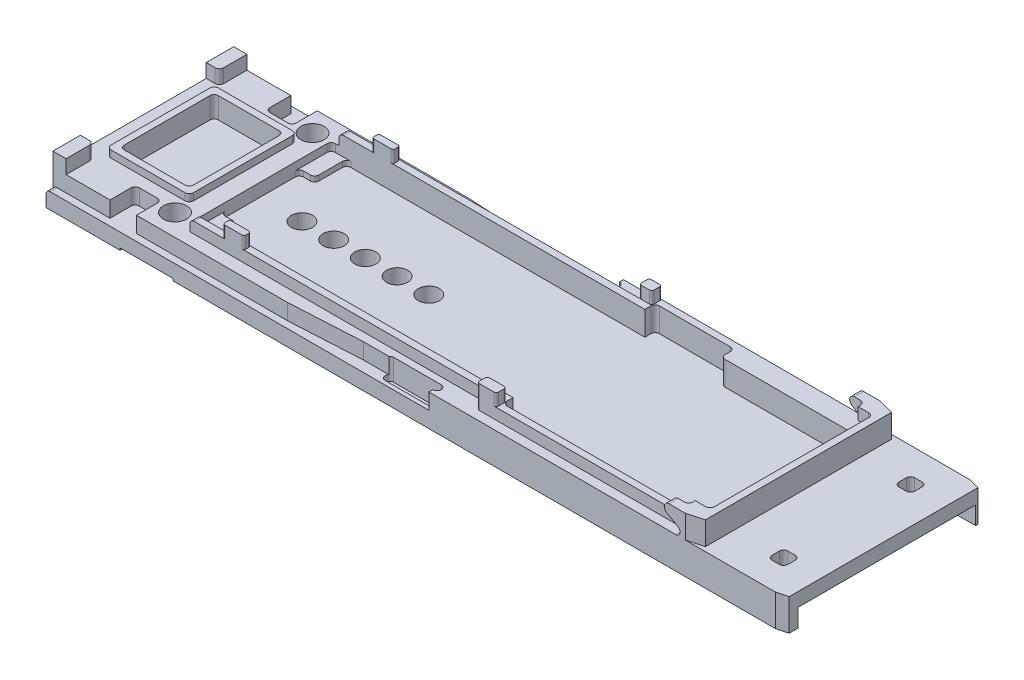
from build123d import *
from OCP.BRepFilletAPI import BRepFilletAPI_MakeChamfer

# Parameters (mm, degrees)
SKETCH1_W                                    = 70
SKETCH1_H                                    = 18.4
BOSS_EXTRUDE1_DEPTH                          = 4.05
CUT_EXTRUDE1_DEPTH                           = 2.28
SKETCH5_W                                    = 6.55
SKETCH5_H                                    = 8.9
CUT_EXTRUDE2_DEPTH                           = 2.38
SKETCH17_W                                   = 70
SKETCH17_H                                   = 18.4
CUT_EXTRUDE8_DEPTH                           = 1.05
SKETCH18_W                                   = 7.8
SKETCH18_H                                   = 10.15
SKETCH18_W_2                                 = 6.55
SKETCH18_H_2                                 = 8.9
BOSS_EXTRUDE3_DEPTH                          = 3.67
CSK_FOR_M2_COUNTERSUNK_FLAT_HEAD_SCR_2_COUNT = 2
CSK_FOR_M2_COUNTERSUNK_FLAT_HEAD_SCR_2_PITCH = 13
CUT_EXTRUDE5_DEPTH                           = 2.55
SKETCH19_W                                   = 1.25
SKETCH19_H                                   = 2.6
BOSS_EXTRUDE4_DEPTH                          = 4.3
SKETCH20_W                                   = 2.5
SKETCH20_H                                   = 2.385
CUT_EXTRUDE9_DEPTH                           = 1.5
SKETCH21_W                                   = 2
SKETCH21_H                                   = 0.65
BOSS_EXTRUDE5_DEPTH                          = 5.2
BOSS_EXTRUDE6_DEPTH                          = 5.2
CHAMFER2_SIZE                                = 1.5
CHAMFER2_SIZE2                               = 0.401923789
CHAMFER1_SIZE                                = 1
CHAMFER1_SIZE2                               = 0.267949192
CUT_EXTRUDE10_DEPTH                          = 37.313083042
CUT_EXTRUDE7_DEPTH                           = 0.2
CHAMFER2_OF_MIRROR1_SIZE2                    = 1.5
CHAMFER2_OF_MIRROR1_SIZE                     = 0.401923789
CUT_EXTRUDE12_DEPTH                          = 0.875
CUT_EXTRUDE13_START                          = -0.875
CUT_EXTRUDE13_DEPTH                          = 0.875
SKETCH26_W                                   = 1.8
SKETCH26_H                                   = 0.95
SKETCH26_W_2                                 = 1.18
BOSS_EXTRUDE8_DEPTH                          = 5.2
FILLET1_R                                    = 0.4
FILLET2_R                                    = 0.2
SKETCH23_W                                   = 0.65
SKETCH23_H                                   = 15.4
BOSS_EXTRUDE7_DEPTH                          = 1.15
SKETCH27_W                                   = 13.1
SKETCH27_H                                   = 1.275
BOSS_EXTRUDE9_DEPTH                          = 2.28
FILLET3_R                                    = 0.4
CUT_EXTRUDE11_DEPTH                          = 1.7
SKETCH31_W                                   = 1.45
SKETCH31_H                                   = 3.025
BOSS_EXTRUDE10_DEPTH                         = 0.5
SKETCH32_W                                   = 4.5
SKETCH32_H                                   = 0.65
CUT_EXTRUDE14_DEPTH                          = 0.55
CUT_EXTRUDE15_DEPTH                          = 37.43765223
FILLET5_R                                    = 0.4
FILLET6_R                                    = 0.4
FILLET7_R                                    = 0.4
FILLET8_R                                    = 0.4
SKETCH34_R                                   = 1
CUT_EXTRUDE16_DEPTH                          = 37.351133407
LPATTERN1_COUNT                              = 5
LPATTERN1_PITCH                              = 3


with BuildPart() as part:
    # Sketch1 → Boss-Extrude1 (new body)
    with BuildSketch(Plane(origin=(0, 0, 0), x_dir=(1, 0, 0), z_dir=(0, 1, 0))):
        Rectangle(SKETCH1_W, SKETCH1_H)
    extrude(amount=BOSS_EXTRUDE1_DEPTH)

    # Sketch2 → Cut-Extrude1 (cut)
    with BuildSketch(Plane(origin=(0, 4.05, 0), x_dir=(1, 0, 0), z_dir=(0, 1, 0))):
        Polygon((-23.95, 6.725), (-23.95, -6.725), (6.7, -6.725), (6.7, -7.7), (26.3, -7.7), (26.3, 7.7), (5.7, 7.7), (5.7, 6.725), align=None)
    extrude(amount=-CUT_EXTRUDE1_DEPTH, mode=Mode.SUBTRACT)

    # Sketch5 → Cut-Extrude2 (cut)
    with BuildSketch(Plane(origin=(0, 4.05, 0), x_dir=(1, 0, 0), z_dir=(0, 1, 0))):
        with Locations((-29.475, 0)):
            Rectangle(SKETCH5_W, SKETCH5_H)
    extrude(amount=-CUT_EXTRUDE2_DEPTH, mode=Mode.SUBTRACT)

    # Sketch17 → Cut-Extrude8 (cut)
    with BuildSketch(Plane(origin=(0, 4.05, 0), x_dir=(1, 0, 0), z_dir=(0, 1, 0))):
        Rectangle(SKETCH17_W, SKETCH17_H)
        Polygon((-23.2, 7.375), (-23.2, -7.375), (5.05, -7.375), (5.05, -8.325), (26.95, -8.325), (26.95, 8.325), (5.05, 8.325), (5.05, 7.375), align=None, mode=Mode.SUBTRACT)
    extrude(amount=-CUT_EXTRUDE8_DEPTH, mode=Mode.SUBTRACT)

    # Sketch18 → Boss-Extrude3 (add)
    with BuildSketch(Plane(origin=(0, 0, 0), x_dir=(1, 0, 0), z_dir=(0, 1, 0))):
        with Locations((-29.475, 0)):
            Rectangle(SKETCH18_W, SKETCH18_H)
        with Locations((-29.475, 0)):
            Rectangle(SKETCH18_W_2, SKETCH18_H_2, mode=Mode.SUBTRACT)
    extrude(amount=BOSS_EXTRUDE3_DEPTH)

    # Sketch6 → CSK for M2 Countersunk Flat Head Screw1 (revolve, cut)
    with BuildSketch(Plane(origin=(-25.5, 0, -6.5), x_dir=(0, 0, -1), z_dir=(1, 0, 0))):
        Polygon((0, 0), (0, 4.05), (1.1, 4.05), (1.1, 1.3), (2.2, 0.2), (2.2, 0), align=None)
    csk_for_m2_countersunk_flat_head_screw1 = revolve(axis=Axis((-25.5, -6.35, -6.5), (0, 1, 0)), mode=Mode.SUBTRACT)

    # CSK for M2 Countersunk Flat Head Scr 2: CSK for M2 Countersunk Flat Head Screw1 ×2
    with Locations(*[(0, 0, i * CSK_FOR_M2_COUNTERSUNK_FLAT_HEAD_SCR_2_PITCH) for i in range(1, CSK_FOR_M2_COUNTERSUNK_FLAT_HEAD_SCR_2_COUNT)]):
        add(csk_for_m2_countersunk_flat_head_screw1, mode=Mode.SUBTRACT)

    # Sketch13 → Cut-Extrude5 (cut)
    with BuildSketch(Plane(origin=(0, 4.05, 0), x_dir=(1, 0, 0), z_dir=(0, 1, 0))):
        Polygon((-35, 9.2), (1.2, 9.2), (1.2, 8.175), (-6, 8.175), (-12.8, 8.55), (-35, 8.55), align=None)
    cut_extrude5 = extrude(amount=-CUT_EXTRUDE5_DEPTH, mode=Mode.SUBTRACT)

    # Sketch19 → Boss-Extrude4 (add)
    with BuildSketch(Plane(origin=(0, 0, 0), x_dir=(1, 0, 0), z_dir=(0, 1, 0))):
        with Locations((-34.375, 7.25)):
            Rectangle(SKETCH19_W, SKETCH19_H)
    boss_extrude4 = extrude(amount=BOSS_EXTRUDE4_DEPTH)

    # Sketch20 → Cut-Extrude9 (cut)
    with BuildSketch(Plane(origin=(0, 3, 0), x_dir=(1, 0, 0), z_dir=(0, 1, 0))):
        with Locations((-28.35, 7.3575)):
            Rectangle(SKETCH20_W, SKETCH20_H)
    cut_extrude9 = extrude(amount=-CUT_EXTRUDE9_DEPTH, mode=Mode.SUBTRACT)

    # Sketch21 → Boss-Extrude5 (add)
    with BuildSketch(Plane(origin=(0, 0, 0), x_dir=(1, 0, 0), z_dir=(0, 1, 0))):
        with Locations((-19.1, 7.05)):
            Rectangle(SKETCH21_W, SKETCH21_H)
    boss_extrude5 = extrude(amount=BOSS_EXTRUDE5_DEPTH)

    # Sketch22 → Boss-Extrude6 (add)
    with BuildSketch(Plane.XZ):
        Polygon((24.9, -7.7), (26.95, -7.7), (26.95, -9.2), (22.15, -9.2), (22.15, -8.325), (24.9, -8.325), align=None)
    boss_extrude6 = extrude(amount=-BOSS_EXTRUDE6_DEPTH)

    # Chamfer2
    chamfer2_edges = [part.edges().sort_by_distance(p)[0] for p in [
        (26.95, 4.1, -9.2),
    ]]
    chamfer2_side = [part.faces().sort_by_distance(p)[0] for p in [
        (7.078780224, 1.420191267, -9.2),
    ]]
    chamfer(chamfer2_edges, length=CHAMFER2_SIZE, length2=CHAMFER2_SIZE2, reference=chamfer2_side[0])

    # Chamfer1: one chamfer whose edges measure the first distance from different faces: ONE call of the kernel's chamfer builder (chamfer() names one face for all edges)
    chamfer1_edges_1 = [part.edges().sort_by_distance(p)[0] for p in [
        (35, 1.5, 9.2),
    ]]
    chamfer1_side_1 = [part.faces().sort_by_distance(p)[0] for p in [
        (0, 1.5, 9.2),
    ]]
    chamfer1_edges_2 = [part.edges().sort_by_distance(p)[0] for p in [
        (35, 1.5, -9.2),
    ]]
    chamfer1_side_2 = [part.faces().sort_by_distance(p)[0] for p in [
        (6.691568483, 1.365924153, -9.2),
    ]]
    chamfer1 = BRepFilletAPI_MakeChamfer(part.part.solid().wrapped)
    for e in chamfer1_edges_1:
        chamfer1.Add(CHAMFER1_SIZE, CHAMFER1_SIZE2, e.wrapped, chamfer1_side_1[0].wrapped)  # the first distance lies on this face
    for e in chamfer1_edges_2:
        chamfer1.Add(CHAMFER1_SIZE, CHAMFER1_SIZE2, e.wrapped, chamfer1_side_2[0].wrapped)  # the first distance lies on this face
    add(Compound.cast(chamfer1.Shape()), mode=Mode.REPLACE)

    # Sketch25 → Cut-Extrude10 (cut, through all)
    with BuildSketch(Plane(origin=(0, 3, 0), x_dir=(1, 0, 0), z_dir=(0, 1, 0))):
        with BuildLine():
            Line((31.2, 6.75), (31.9, 6.75))
            ThreePointArc((31.9, 6.75), (32.182842712, 6.632842712), (32.3, 6.35))
            Line((32.3, 6.35), (32.3, 5.65))
            ThreePointArc((32.3, 5.65), (32.182842712, 5.367157288), (31.9, 5.25))
            Line((31.9, 5.25), (31.2, 5.25))
            ThreePointArc((31.2, 5.25), (30.917157288, 5.367157288), (30.8, 5.65))
            Line((30.8, 5.65), (30.8, 6.35))
            ThreePointArc((30.8, 6.35), (30.917157288, 6.632842712), (31.2, 6.75))
        make_face()
    cut_extrude10 = extrude(amount=-CUT_EXTRUDE10_DEPTH, mode=Mode.SUBTRACT)

    # Sketch16 → Cut-Extrude7 (cut)
    with BuildSketch(Plane.XZ):
        with BuildLine():
            Line((-28, -9.2), (-28, -6.5))
            ThreePointArc((-28, -6.5), (-25.5, -4), (-23, -6.5))
            Line((-23, -6.5), (-23, -9.2))
            Line((-23, -9.2), (-28, -9.2))
        make_face()
    cut_extrude7 = extrude(amount=-CUT_EXTRUDE7_DEPTH, mode=Mode.SUBTRACT)

    # Mirror1: Cut-Extrude5, Boss-Extrude4, Cut-Extrude9, Boss-Extrude5, Boss-Extrude6, Cut-Extrude10, Cut-Extrude7 across plane
    add(cut_extrude5.mirror(Plane.XY), mode=Mode.SUBTRACT)
    add(boss_extrude4.mirror(Plane.XY))
    add(cut_extrude9.mirror(Plane.XY), mode=Mode.SUBTRACT)
    add(boss_extrude5.mirror(Plane.XY))
    add(boss_extrude6.mirror(Plane.XY))
    add(cut_extrude10.mirror(Plane.XY), mode=Mode.SUBTRACT)
    add(cut_extrude7.mirror(Plane.XY), mode=Mode.SUBTRACT)

    # Chamfer2 of Mirror1
    chamfer2_of_mirror1_edges = [part.edges().sort_by_distance(p)[0] for p in [
        (26.95, 4.1, 9.2),
    ]]
    chamfer(chamfer2_of_mirror1_edges, length=CHAMFER2_OF_MIRROR1_SIZE, length2=CHAMFER2_OF_MIRROR1_SIZE2)

    # Sketch29 → Cut-Extrude12 (cut)
    with BuildSketch(Plane.XY.offset(-9.2)):
        with BuildLine():
            Line((23.693911087, 4.360288568), (24.757179677, 3.746410162))
            ThreePointArc((24.757179677, 3.746410162), (24.943550007, 3.296472382), (24.557179677, 3))
            Line((24.557179677, 3), (21.557179677, 3))
            Line((21.557179677, 3), (21.557179677, 5.2))
            Line((21.557179677, 5.2), (23.918911087, 5.2))
            ThreePointArc((23.918911087, 5.2), (23.484244465, 4.86646857), (23.693911087, 4.360288568))
        make_face()
    extrude(amount=CUT_EXTRUDE12_DEPTH, mode=Mode.SUBTRACT)

    # Sketch30 → Cut-Extrude13 (cut)
    with BuildSketch(Plane.XY.offset(9.2).offset(CUT_EXTRUDE13_START)):
        with BuildLine():
            Line((23.693911087, 4.360288568), (24.757179677, 3.746410162))
            ThreePointArc((24.757179677, 3.746410162), (24.943550007, 3.296472382), (24.557179677, 3))
            Line((24.557179677, 3), (21.557179677, 3))
            Line((21.557179677, 3), (21.557179677, 5.2))
            Line((21.557179677, 5.2), (23.918911087, 5.2))
            ThreePointArc((23.918911087, 5.2), (23.484244465, 4.86646857), (23.693911087, 4.360288568))
        make_face()
    extrude(amount=CUT_EXTRUDE13_DEPTH, mode=Mode.SUBTRACT)

    # Sketch26 → Boss-Extrude8 (add)
    with BuildSketch(Plane.XZ):
        with Locations((5.8, 7.85)):
            Rectangle(SKETCH26_W, SKETCH26_H)
        with Locations((5.11, -7.85)):
            Rectangle(SKETCH26_W_2, SKETCH26_H)
    extrude(amount=-BOSS_EXTRUDE8_DEPTH)

    # Fillet1
    fillet1_edges = [part.edges().sort_by_distance(p)[0] for p in [
        (-23.2, 4.05, -7.05),
        (-23.2, 4.05, 7.05),
    ]]
    fillet(fillet1_edges, radius=FILLET1_R)

    # Fillet2
    fillet2_edges = [part.edges().sort_by_distance(p)[0] for p in [
        (-20.1, 4.625, -7.375),
        (-20.1, 4.625, -6.725),
        (-18.1, 4.625, -6.725),
        (-18.1, 4.625, -7.375),
        (-20.1, 4.625, 6.725),
        (-20.1, 4.625, 7.375),
        (-18.1, 4.625, 7.375),
        (-18.1, 4.625, 6.725),
        (4.9, 4.1, 8.325),
        (6.7, 4.625, 7.375),
        (6.7, 4.625, 8.325),
        (4.9, 4.625, 7.375),
        (5.7, 4.625, -7.375),
        (5.7, 4.625, -8.325),
        (4.52, 4.1, -8.325),
        (4.52, 4.625, -7.375),
    ]]
    fillet(fillet2_edges, radius=FILLET2_R)

    # Sketch23 → Boss-Extrude7 (add)
    with BuildSketch(Plane(origin=(0, 4.05, 0), x_dir=(1, 0, 0), z_dir=(0, 1, 0))):
        with Locations((26.625, 0)):
            Rectangle(SKETCH23_W, SKETCH23_H)
    extrude(amount=BOSS_EXTRUDE7_DEPTH)

    # Sketch27 → Boss-Extrude9 (add)
    with BuildSketch(Plane(origin=(0, 1.77, 0), x_dir=(1, 0, 0), z_dir=(0, 1, 0))):
        with Locations((19.75, 7.0625)):
            Rectangle(SKETCH27_W, SKETCH27_H)
    extrude(amount=BOSS_EXTRUDE9_DEPTH)

    # Fillet3
    fillet3_edges = [part.edges().sort_by_distance(p)[0] for p in [
        (13.2, 2.91, -7.7),
        (13.2, 2.91, -6.425),
    ]]
    fillet(fillet3_edges, radius=FILLET3_R)

    # Sketch28 → Cut-Extrude11 (cut)
    with BuildSketch(Plane.XZ):
        Polygon((35, 8.1), (30.8, 8.1), (30.8, -7), (14.2, -7), (14.2, -8.7), (35, -8.7), align=None)
    extrude(amount=-CUT_EXTRUDE11_DEPTH, mode=Mode.SUBTRACT)

    # Sketch31 → Boss-Extrude10 (add)
    with BuildSketch(Plane(origin=(0, 1.77, 0), x_dir=(1, 0, 0), z_dir=(0, 1, 0))):
        with Locations((-23.225, 5.2125)):
            Rectangle(SKETCH31_W, SKETCH31_H)
        with Locations((-23.225, -5.2125)):
            Rectangle(SKETCH31_W, SKETCH31_H)
    extrude(amount=BOSS_EXTRUDE10_DEPTH)

    # Sketch32 → Cut-Extrude14 (cut)
    with BuildSketch(Plane(origin=(0, 1.5, 0), x_dir=(1, 0, 0), z_dir=(0, 1, 0))):
        with Locations((-1.05, 8.5)):
            Rectangle(SKETCH32_W, SKETCH32_H)
        with Locations((-1.05, -8.5)):
            Rectangle(SKETCH32_W, SKETCH32_H)
    extrude(amount=-CUT_EXTRUDE14_DEPTH, mode=Mode.SUBTRACT)

    # Sketch33 → Cut-Extrude15 (cut, through all)
    with BuildSketch(Plane(origin=(0, 0.95, 0), x_dir=(1, 0, 0), z_dir=(0, 1, 0))):
        with BuildLine():
            Line((-3.3, -8.825), (1.2, -8.825))
            ThreePointArc((1.2, -8.825), (1.6, -8.425), (1.2, -8.025))
            Line((1.2, -8.025), (-3.3, -8.025))
            ThreePointArc((-3.3, -8.025), (-3.7, -8.425), (-3.3, -8.825))
        make_face()
    cut_extrude15 = extrude(amount=CUT_EXTRUDE15_DEPTH, mode=Mode.SUBTRACT)

    # Mirror2: Cut-Extrude15 across plane
    add(cut_extrude15.mirror(Plane.XY), mode=Mode.SUBTRACT)

    # Fillet5
    # the kernel refuses this fillet: 0.4 mm, written as the material it adds along each edge
    with BuildSketch(Plane(origin=(5.7, 4.05, -7.7), x_dir=(0, 0, 1), z_dir=(0, -1, 0)), Plane(origin=(6.7, 4.05, 7.7), x_dir=(1, 0, 0), z_dir=(0, -1, 0))) as fillet5_piece_1:
        with BuildLine():
            CenterArc((FILLET5_R, -FILLET5_R), FILLET5_R, 90, 90)
            Line((0, -FILLET5_R), (0, 0))
            Line((0, 0), (FILLET5_R, 0))
        make_face()
    extrude(amount=3.28)
    with BuildSketch(Plane(origin=(26.3, 5.2, 7.7), x_dir=(0, 0, -1), z_dir=(0, -1, 0))) as fillet5_piece_2:
        with BuildLine():
            CenterArc((FILLET5_R, -FILLET5_R), FILLET5_R, 90, 90)
            Line((0, -FILLET5_R), (0, 0))
            Line((0, 0), (FILLET5_R, 0))
        make_face()
    extrude(amount=4.43)
    with BuildSketch(Plane(origin=(-29.6, 3, -6.165), x_dir=(1, 0, 0), z_dir=(0, -1, 0)), Plane(origin=(-29.6, 3, 6.165), x_dir=(0, 0, 1), z_dir=(0, -1, 0))) as fillet5_piece_3:
        with BuildLine():
            CenterArc((FILLET5_R, -FILLET5_R), FILLET5_R, 90, 90)
            Line((0, -FILLET5_R), (0, 0))
            Line((0, 0), (FILLET5_R, 0))
        make_face()
    extrude(amount=2.5)
    with BuildSketch(Plane(origin=(-27.1, 3, -6.165), x_dir=(0, 0, -1), z_dir=(0, -1, 0)), Plane(origin=(-27.1, 3, 6.165), x_dir=(-1, 0, 0), z_dir=(0, -1, 0))) as fillet5_piece_4:
        with BuildLine():
            CenterArc((FILLET5_R, -FILLET5_R), FILLET5_R, 90, 90)
            Line((0, -FILLET5_R), (0, 0))
            Line((0, 0), (FILLET5_R, 0))
        make_face()
    extrude(amount=1.5)
    with BuildSketch(Plane(origin=(24.9, 3.05, -8.325), x_dir=(0, 0, 1), z_dir=(0, 1, 0))) as fillet5_piece_5:
        with BuildLine():
            CenterArc((FILLET5_R, -FILLET5_R), FILLET5_R, 90, 90)
            Line((0, -FILLET5_R), (0, 0))
            Line((0, 0), (FILLET5_R, 0))
        make_face()
    extrude(amount=2.15)
    with BuildSketch(Plane(origin=(-26.2, 0.67, -4.45), x_dir=(-1, 0, 0), z_dir=(0, 1, 0)), Plane(origin=(-26.2, 0.67, 4.45), x_dir=(0, 0, -1), z_dir=(0, 1, 0)), Plane(origin=(-32.75, 0.67, 4.45), x_dir=(1, 0, 0), z_dir=(0, 1, 0)), Plane(origin=(-32.75, 3.67, -4.45), x_dir=(1, 0, 0), z_dir=(0, -1, 0))) as fillet5_piece_6:
        with BuildLine():
            CenterArc((FILLET5_R, FILLET5_R), FILLET5_R, 180, 90)
            Line((0, FILLET5_R), (0, 0))
            Line((0, 0), (FILLET5_R, 0))
        make_face()
    extrude(amount=3)
    with BuildSketch(Plane(origin=(24.9, 3.05, 8.325), x_dir=(0, 0, -1), z_dir=(0, 1, 0)), Plane(origin=(26.3, 5.2, -7.7), x_dir=(0, 0, 1), z_dir=(0, -1, 0))) as fillet5_piece_7:
        with BuildLine():
            CenterArc((FILLET5_R, FILLET5_R), FILLET5_R, 180, 90)
            Line((0, FILLET5_R), (0, 0))
            Line((0, 0), (FILLET5_R, 0))
        make_face()
    extrude(amount=2.15)
    with BuildSketch(Plane(origin=(26.3, 0.77, -6.425), x_dir=(-1, 0, 0), z_dir=(0, 1, 0))) as fillet5_piece_8:
        with BuildLine():
            CenterArc((FILLET5_R, FILLET5_R), FILLET5_R, 180, 90)
            Line((0, FILLET5_R), (0, 0))
            Line((0, 0), (FILLET5_R, 0))
        make_face()
    extrude(amount=3.28)
    with BuildSketch(Plane(origin=(14.2, 0, -8.7), x_dir=(1, 0, 0), z_dir=(0, 1, 0)), Plane(origin=(14.2, 0, -7), x_dir=(0, 0, -1), z_dir=(0, 1, 0)), Plane(origin=(30.8, 0, 8.1), x_dir=(0, 0, -1), z_dir=(0, 1, 0))) as fillet5_piece_9:
        with BuildLine():
            CenterArc((FILLET5_R, -FILLET5_R), FILLET5_R, 90, 90)
            Line((0, -FILLET5_R), (0, 0))
            Line((0, 0), (FILLET5_R, 0))
        make_face()
    extrude(amount=2.7)
    with BuildSketch(Plane(origin=(-23.95, 3, -6.725), x_dir=(0, 0, 1), z_dir=(0, -1, 0)), Plane(origin=(-23.95, 3, 6.725), x_dir=(1, 0, 0), z_dir=(0, -1, 0))) as fillet5_piece_10:
        with BuildLine():
            CenterArc((FILLET5_R, -FILLET5_R), FILLET5_R, 90, 90)
            Line((0, -FILLET5_R), (0, 0))
            Line((0, 0), (FILLET5_R, 0))
        make_face()
    extrude(amount=1.73)
    with BuildSketch(Plane(origin=(-23.95, 0.77, -3.7), x_dir=(0, 0, 1), z_dir=(0, 1, 0)), Plane(origin=(-22.5, 0.77, -6.725), x_dir=(0, 0, 1), z_dir=(0, 1, 0)), Plane(origin=(-23.95, 0.77, 3.7), x_dir=(1, 0, 0), z_dir=(0, 1, 0)), Plane(origin=(-22.5, 0.77, 6.725), x_dir=(1, 0, 0), z_dir=(0, 1, 0))) as fillet5_piece_11:
        with BuildLine():
            CenterArc((FILLET5_R, FILLET5_R), FILLET5_R, 180, 90)
            Line((0, FILLET5_R), (0, 0))
            Line((0, 0), (FILLET5_R, 0))
        make_face()
    extrude(amount=1.5)

    # Fillet6
    fillet6_edges = [part.edges().sort_by_distance(p)[0] for p in [
        (-22.5, 2.02, -3.7),
        (-22.5, 2.02, 3.7),
    ]]
    fillet(fillet6_edges, radius=FILLET6_R)

    # Fillet7
    fillet7_edges = [part.edges().sort_by_distance(p)[0] for p in [
        (-35, 1.5, -8.875),
        (-35, 1.5, 8.875),
    ]]
    fillet(fillet7_edges, radius=FILLET7_R)

    # Fillet8
    fillet8_edges = [part.edges().sort_by_distance(p)[0] for p in [
        (-25.575, 3.335, -5.075),
        (-33.375, 3.335, -5.075),
        (-33.375, 3.335, 5.075),
        (-25.575, 3.335, 5.075),
        (-33.75, 3.65, -5.95),
        (-33.75, 3.65, 5.95),
    ]]
    fillet(fillet8_edges, radius=FILLET8_R)

    # Sketch34 → Cut-Extrude16 (cut, through all)
    with BuildSketch(Plane(origin=(0, 1.77, 0), x_dir=(1, 0, 0), z_dir=(0, 1, 0))):
        with Locations(Location((-20, 0, 0), (0, 0, 270))):
            Circle(SKETCH34_R)
    cut_extrude16 = extrude(amount=-CUT_EXTRUDE16_DEPTH, mode=Mode.SUBTRACT)

    # LPattern1: Cut-Extrude16 ×5
    with Locations(*[(i * LPATTERN1_PITCH, 0, 0) for i in range(1, LPATTERN1_COUNT)]):
        add(cut_extrude16, mode=Mode.SUBTRACT)


solid = part.part
